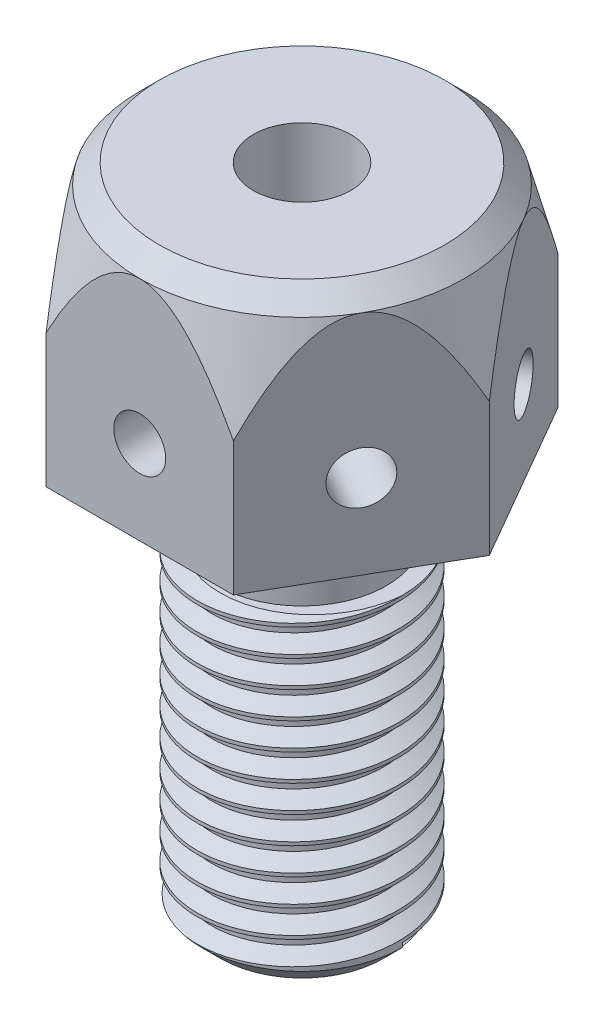
from build123d import *

# Parameters (mm, degrees)
SKETCH1_R           = 3.937
BOSS_EXTRUDE1_DEPTH = 12.7
CHAMFER1_SIZE       = 0.762
THREAD1_PITCH       = 1.058333333
SKETCH4_R           = 3.302
BOSS_EXTRUDE2_DEPTH = 3.048
BOSS_EXTRUDE3_DEPTH = 8.89
SKETCH6_R           = 6.35
BOSS_EXTRUDE4_DEPTH = 0.762
CHAMFER2_SIZE       = 0.762
SKETCH9_R           = 1.016
CUT_EXTRUDE1_DEPTH  = 6.35
CIRPATTERN1_COUNT   = 6
SKETCH10_R          = 1.905
CUT_EXTRUDE2_DEPTH  = 7.874


with BuildPart() as part:
    # Sketch1 → Boss-Extrude1 (new body)
    with BuildSketch(Plane(origin=(0, 0, 0), x_dir=(1, 0, 0), z_dir=(0, 1, 0))):
        with Locations(Location((0, 0, 0), (0, 0, 270))):
            Circle(SKETCH1_R)
    extrude(amount=BOSS_EXTRUDE1_DEPTH)

    # Chamfer1
    chamfer1_edges = [part.edges().sort_by_distance(p)[0] for p in [
        (0, 0, -3.937),
    ]]
    chamfer(chamfer1_edges, length=CHAMFER1_SIZE)

    # Thread1: the profile of Thread Profile1 profile screwed along a right-hand helix of 12 turns, 8 arcs to a turn; built about Z, then put on its axis
    thread1_z = Axis((0, 0, 0), (0, 0, 1))
    thread1_corners = [(3.9373, 0, -0.000173205), (3.9373, 0, 0.926214869), (3.364160282, 0, 0.595312499), (3.364160282, 0, 0.330729165)]
    with BuildLine(mode=Mode.PRIVATE) as thread1_profile:
        Line(thread1_corners[0], thread1_corners[1])
        Line(thread1_corners[1], thread1_corners[2])
        Line(thread1_corners[2], thread1_corners[3])
        Line(thread1_corners[3], thread1_corners[0])
    thread1_cap = Face(thread1_profile.wire())
    thread1_turn_angles = [0, 22.5, 45, 67.5, 90, 112.5, 135, 157.5, 180, 202.5, 225, 247.5, 270, 292.5, 315, 337.5, 360]
    thread1_turn_weights = [1, 0.9238795325112867, 1, 0.9238795325112867, 1, 0.9238795325112867, 1, 0.9238795325112867, 1, 0.9238795325112867, 1, 0.9238795325112867, 1, 0.9238795325112867, 1, 0.9238795325112867, 1]
    thread1_turn_rails = [Edge.make_bspline([Vector(p[0], p[1], 0).rotate(thread1_z, thread1_turn_angles[k]) / thread1_turn_weights[k] + Vector(0, 0, p[2] + THREAD1_PITCH * thread1_turn_angles[k] / 360) for k in range(17)], [0, 0, 0, 1, 1, 2, 2, 3, 3, 4, 4, 5, 5, 6, 6, 7, 7, 8, 8, 8], 2, thread1_turn_weights) for p in thread1_corners]
    thread1_turn_sides = [Face.make_surface_from_curves(thread1_turn_rails[p[0]], thread1_turn_rails[p[1]]) for p in [(0, 1), (1, 2), (2, 3), (3, 0)]]
    thread1 = Plane(origin=(0, 0, 0), x_dir=(1, 0, 0), z_dir=(0, 1, 0)) * Solid(Shell([*[p.moved(Location((0, 0, THREAD1_PITCH * i))) for i in range(12) for p in thread1_turn_sides], thread1_cap, thread1_cap.rotate(thread1_z, 4320).moved(Location((0, 0, THREAD1_PITCH * 4320 / 360)))]))
    add(thread1, mode=Mode.SUBTRACT)

    # Sketch4 → Boss-Extrude2 (add)
    with BuildSketch(Plane(origin=(0, 12.7, 0), x_dir=(1, 0, 0), z_dir=(0, 1, 0))):
        with Locations(Location((0, 0, 0), (0, 0, 90))):
            Circle(SKETCH4_R)
    extrude(amount=BOSS_EXTRUDE2_DEPTH)

    # Sketch5 → Boss-Extrude3 (add)
    with BuildSketch(Plane(origin=(0, 15.748, 0), x_dir=(1, 0, 0), z_dir=(0, 1, 0))):
        Polygon((3.666174209, 6.35), (-3.666174209, 6.35), (-7.332348419, 0), (-3.666174209, -6.35), (3.666174209, -6.35), (7.332348419, 0), align=None)
    extrude(amount=BOSS_EXTRUDE3_DEPTH)

    # Sketch6 → Boss-Extrude4 (add)
    with BuildSketch(Plane(origin=(0, 24.638, 0), x_dir=(1, 0, 0), z_dir=(0, 1, 0))):
        with Locations(Location((0, 0, 0), (0, 0, 270))):
            Circle(SKETCH6_R)
    extrude(amount=BOSS_EXTRUDE4_DEPTH)

    # Chamfer2
    chamfer2_edges = [part.edges().sort_by_distance(p)[0] for p in [
        (0, 25.4, -6.35),
    ]]
    chamfer(chamfer2_edges, length=CHAMFER2_SIZE - 0.0001)  # a hair under: the kernel refuses the full size

    # Cut-Sweep1: sweep along a curve in space
    with BuildLine() as cut_sweep1_path:
        ThreePointArc((0, 15.748, 3.302), (2.334866591, 15.748, 2.334866591), (3.302, 15.748, 0))
        ThreePointArc((3.302, 15.748, 0), (2.334866591, 15.748, -2.334866591), (0, 15.748, -3.302))
        ThreePointArc((0, 15.748, -3.302), (-2.334866591, 15.748, -2.334866591), (-3.302, 15.748, 0))
        ThreePointArc((-3.302, 15.748, 0), (-2.334866591, 15.748, 2.334866591), (0, 15.748, 3.302))
    # Sketch7 → Cut-Sweep1 (sweep, cut)
    with BuildSketch(Plane(origin=(0, 0, 0), x_dir=(-0.5000000000000001, 0, 0.8660254037844386), z_dir=(-0.8660254037844386, 0, -0.5000000000000001))):
        Polygon((-6.35, 24.638), (-7.332348419, 24.638), (-7.332348419, 20.971825791), align=None)
    sweep(path=cut_sweep1_path.line, mode=Mode.SUBTRACT)

    # Sketch9 → Cut-Extrude1 (cut)
    with BuildSketch(Plane(origin=(5.499261314, 0, -3.175), x_dir=(-0.5000000000000001, 0, -0.8660254037844386), z_dir=(0.8660254037844386, 0, -0.5000000000000001))):
        with Locations((0, 19.05)):
            Circle(SKETCH9_R)
    cut_extrude1 = extrude(amount=-CUT_EXTRUDE1_DEPTH, mode=Mode.SUBTRACT)

    # CirPattern1: Cut-Extrude1 ×6 about axis
    cirpattern1_axis = Axis((0, 15.748, 0), (0, 1, 0))
    for i in range(1, CIRPATTERN1_COUNT):
        add(cut_extrude1.rotate(cirpattern1_axis, i * 360 / CIRPATTERN1_COUNT), mode=Mode.SUBTRACT)

    # Sketch10 → Cut-Extrude2 (cut)
    with BuildSketch(Plane(origin=(0, 25.4, 0), x_dir=(1, 0, 0), z_dir=(0, 1, 0))):
        with Locations(Location((0, 0, 0), (0, 0, 270))):
            Circle(SKETCH10_R)
    extrude(amount=-CUT_EXTRUDE2_DEPTH, mode=Mode.SUBTRACT)


solid = part.part
